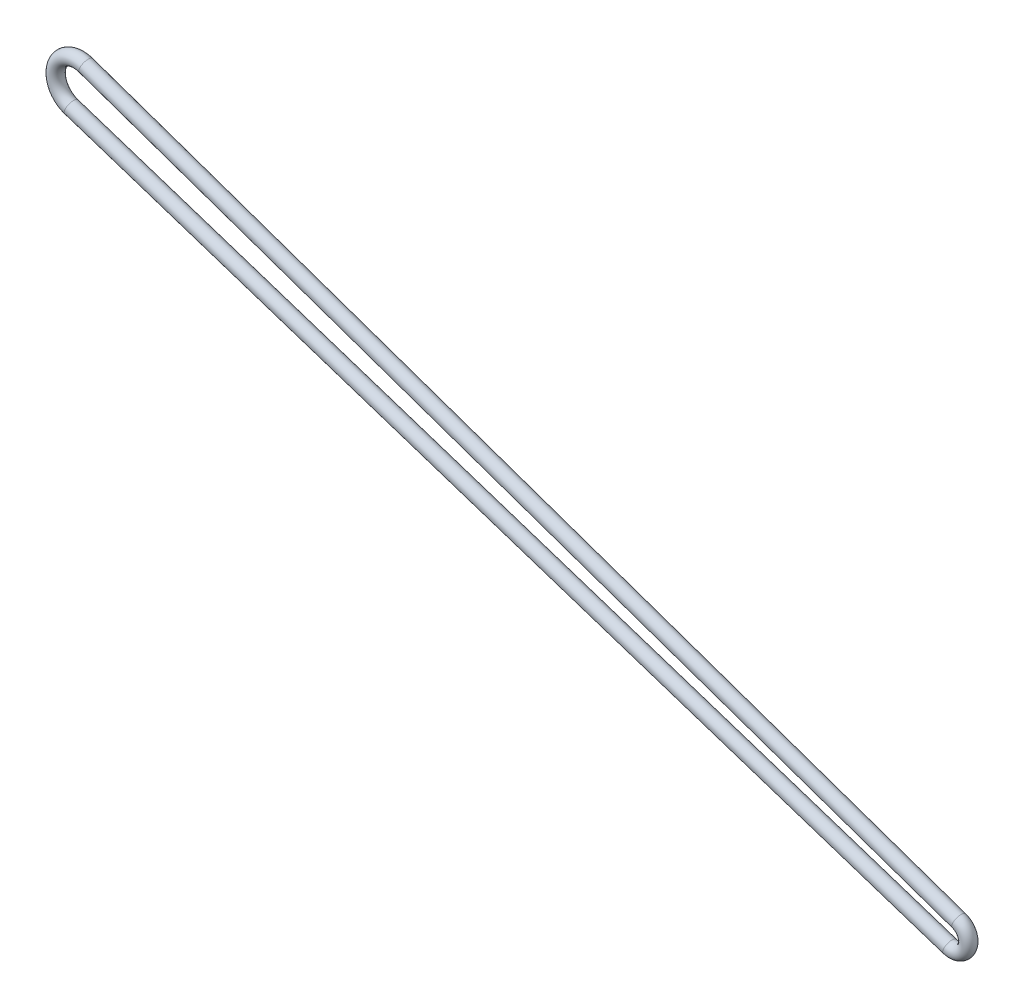
from build123d import *

# Parameters (mm, degrees)
SWEEP_19_PROFILE_R = 1.5


with BuildPart() as part:
    # 扫描19: sweep along a path in 草图2
    with BuildLine(Plane.XY) as sweep_19_path:
        Line((317.042464793, 88.499449786), (124.303885017, 151.637179228))
        ThreePointArc((124.303885017, 151.637179228), (121.123647217, 157.989696106), (127.505676759, 161.110286128))
        Line((127.505676759, 161.110286128), (319.027575673, 94.372776064))
        ThreePointArc((319.027575673, 94.372776064), (320.944301354, 90.452812265), (317.042464793, 88.499449786))
    # 扫描19 profile (on start of the path) → 扫描19 (sweep)
    with BuildSketch(Plane(origin=(317.042464793, 88.499449786, 0), x_dir=(-0.3113046974964248, -0.9503101521696269, 0), z_dir=(-0.9503101521696269, 0.3113046974964248, 0))):
        Circle(SWEEP_19_PROFILE_R)
    sweep(path=sweep_19_path.line)


solid = part.part
